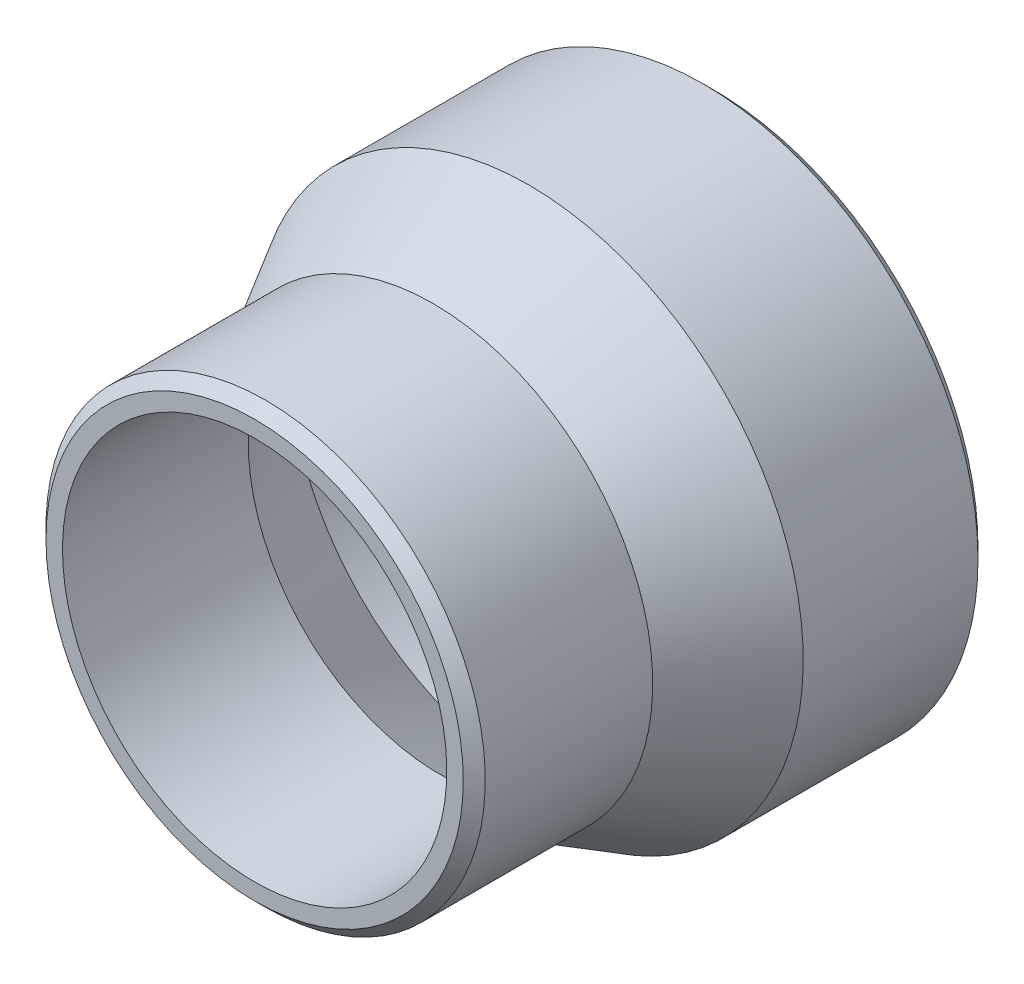
from build123d import *

# Parameters (mm, degrees)
CHAMFER1_SIZE = 2.54


with BuildPart() as part:
    # Sketch1 → Revolve1 (revolve)
    with BuildSketch(Plane(origin=(0, 0, 0), x_dir=(0, 0, -1), z_dir=(1, 0, 0))):
        Polygon((-65.0875, 50.8), (-106.3625, 50.8), (-106.3625, 44.45), (-63.394166667, 44.45), (-41.275, 57.15), (0, 57.15), (0, 63.5), (-42.968333333, 63.5), align=None)
    revolve(axis=Axis((0, 0, 0), (0, 0, 1)))

    # Chamfer1
    chamfer1_edges = [part.edges().sort_by_distance(p)[0] for p in [
        (0, -63.5, 0),
        (0, -50.8, 106.3625),
    ]]
    chamfer(chamfer1_edges, length=CHAMFER1_SIZE)


solid = part.part
